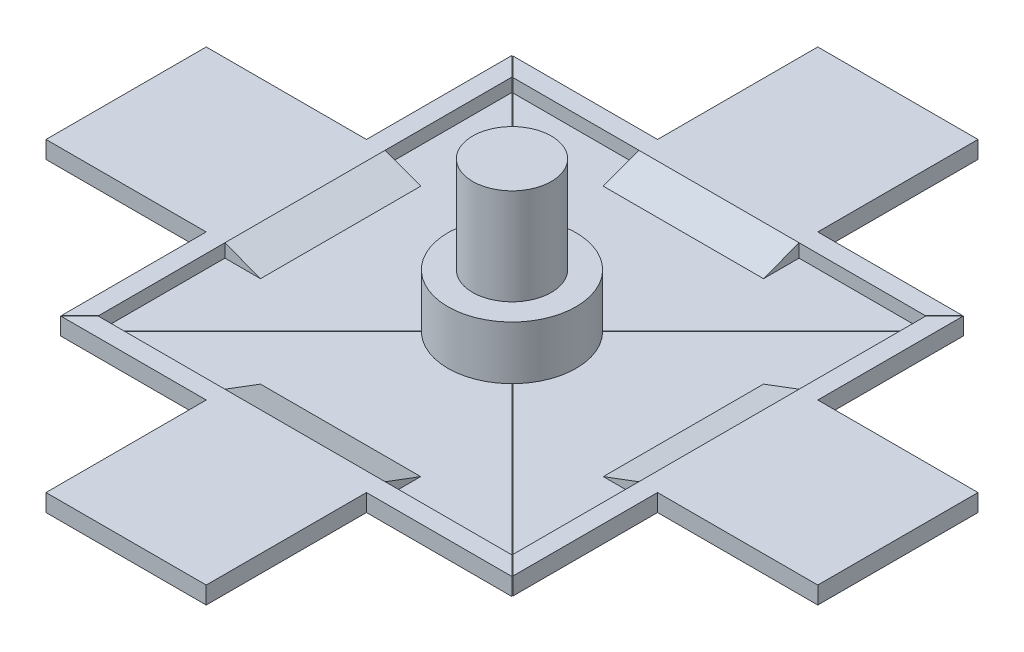
from build123d import *

# Parameters (mm, degrees)
PLYWOOD_BASE_DEPTH           = 19.05
FIELD_LAYOUT_3_W             = 1968.5
FIELD_LAYOUT_3_H             = 1968.5
RAISED_BASE_DEPTH            = 63.5
FIELD_LAYOUT_4_W             = 762
FIELD_LAYOUT_4_H             = 169.138249808
RAMP_EXTRUDE_DEPTH           = 63.5
CUT_RAMP_SLOPE_REACH         = 2880.042
COPY_RAMP_SLOPE_COUNT        = 4
SKETCH5_R                    = 304.8
BOSS_EXTRUDE1_DEPTH          = 254
CUT_EXTRUDE_THIN1_DEPTH      = 2608.693817341
CUT_EXTRUDE_THIN1_DEPTH_BACK = 2608.693817341
SKETCH6_R                    = 187.226802171
BOSS_EXTRUDE2_DEPTH          = 457.2


with BuildPart() as part:
    # Field Layout → Plywood Base (new body)
    with BuildSketch(Plane(origin=(0, 0, 0), x_dir=(1, 0, 0), z_dir=(0, 1, 0))):
        Polygon((-381, 1073.15), (-1073.15, 1073.15), (-1073.15, 381), (-1835.15, 381), (-1835.15, -381), (-1073.15, -381), (-1073.15, -1073.15), (-381, -1073.15), (-381, -1835.15), (381, -1835.15), (381, -1073.15), (1073.15, -1073.15), (1073.15, -381), (1835.15, -381), (1835.15, 381), (1073.15, 381), (1073.15, 1073.15), (381, 1073.15), (381, 1835.15), (-381, 1835.15), align=None)
    extrude(amount=-PLYWOOD_BASE_DEPTH)

    # Field Layout<3> → Raised Base (add)
    with BuildSketch(Plane(origin=(0, 0, 0), x_dir=(1, 0, 0), z_dir=(0, 1, 0))):
        Polygon((-381, 1073.15), (-1073.15, 1073.15), (-1073.15, 381), (-1835.15, 381), (-1835.15, -381), (-1073.15, -381), (-1073.15, -1073.15), (-381, -1073.15), (-381, -1835.15), (381, -1835.15), (381, -1073.15), (1073.15, -1073.15), (1073.15, -381), (1835.15, -381), (1835.15, 381), (1073.15, 381), (1073.15, 1073.15), (381, 1073.15), (381, 1835.15), (-381, 1835.15), align=None)
        Rectangle(FIELD_LAYOUT_3_W, FIELD_LAYOUT_3_H, mode=Mode.SUBTRACT)
    extrude(amount=RAISED_BASE_DEPTH)

    # Field Layout<4> → Ramp Extrude (add)
    with BuildSketch(Plane(origin=(0, 0, 0), x_dir=(1, 0, 0), z_dir=(0, 1, 0))):
        with Locations((0, -899.680875096)):
            Rectangle(FIELD_LAYOUT_4_W, FIELD_LAYOUT_4_H)
    ramp_extrude = extrude(amount=RAMP_EXTRUDE_DEPTH)

    # Sketch3 → Cut ramp slope (cut, up to next)
    with BuildSketch(Plane(origin=(381, 0, 0), x_dir=(0, 0, -1), z_dir=(1, 0, 0)), mode=Mode.PRIVATE) as cut_ramp_slope_sk1:
        Polygon((-815.111750192, 63.5), (-984.25, 63.5), (-815.111750192, 0), align=None)
    cut_ramp_slope_tool1 = extrude(cut_ramp_slope_sk1.sketch, amount=-CUT_RAMP_SLOPE_REACH, mode=Mode.PRIVATE) & part.part
    cut_ramp_slope = cut_ramp_slope_tool1.solids().sort_by_distance((381, 42.333333, 871.491167))[0]
    add(cut_ramp_slope, mode=Mode.SUBTRACT)

    # Copy Ramp Slope: Ramp Extrude, Cut ramp slope ×4 about axis
    copy_ramp_slope_axis = Axis((0, -19.05, 0), (0, -1, 0))
    add([ramp_extrude.rotate(copy_ramp_slope_axis, i * 360 / COPY_RAMP_SLOPE_COUNT) for i in range(1, COPY_RAMP_SLOPE_COUNT)])
    add([cut_ramp_slope.rotate(copy_ramp_slope_axis, i * 360 / COPY_RAMP_SLOPE_COUNT) for i in range(1, COPY_RAMP_SLOPE_COUNT)], mode=Mode.SUBTRACT)

    # Sketch4 → Cut-Extrude-Thin1 (cut, two sides: drawn at the far end of the back side and taken through both)
    with BuildSketch(Plane(origin=(0, 0, 0), x_dir=(1, 0, 0), z_dir=(0, 1, 0)).offset(-CUT_EXTRUDE_THIN1_DEPTH_BACK)):
        Polygon((-1073.15, -1073.15), (-984.25, -984.25), (984.25, 984.25), (1073.15, 1073.15), (1071.353948776, 1074.946051224), (982.453948776, 986.046051224), (-986.046051224, -982.453948776), (-1074.946051224, -1071.353948776), align=None)
        Polygon((-1073.15, 1073.15), (-984.25, 984.25), (984.25, -984.25), (1073.15, -1073.15), (1074.946051224, -1071.353948776), (986.046051224, -982.453948776), (-982.453948776, 986.046051224), (-1071.353948776, 1074.946051224), align=None)
    extrude(amount=CUT_EXTRUDE_THIN1_DEPTH + CUT_EXTRUDE_THIN1_DEPTH_BACK, mode=Mode.SUBTRACT)


with BuildPart() as body_2:
    # Sketch5 → Boss-Extrude1 (new body)
    with BuildSketch(Plane(origin=(0, 0, 0), x_dir=(1, 0, 0), z_dir=(0, 1, 0))):
        Circle(SKETCH5_R)
    extrude(amount=BOSS_EXTRUDE1_DEPTH)

    # Sketch6 → Boss-Extrude2 (add)
    with BuildSketch(Plane(origin=(0, 254, 0), x_dir=(1, 0, 0), z_dir=(0, 1, 0))):
        Circle(SKETCH6_R)
    extrude(amount=BOSS_EXTRUDE2_DEPTH)


with BuildPart() as cut_extrude_thin1_piece_1:
    # of the separate pieces the step leaves, piece 1, a body of its own (cut_extrude_thin1_pieces)
    add(part.part.solids().sort_by_distance((0, -19.05, 0))[0])


with BuildPart() as cut_extrude_thin1_piece_2:
    # of the separate pieces the step leaves, piece 2, a body of its own (cut_extrude_thin1_pieces)
    add(part.part.solids().sort_by_distance((-1073.15, -19.05, -1073.15))[0])


with BuildPart() as cut_extrude_thin1_piece_3:
    # of the separate pieces the step leaves, piece 3, a body of its own (cut_extrude_thin1_pieces)
    add(part.part.solids().sort_by_distance((1073.15, 63.5, -381))[0])


with BuildPart() as cut_extrude_thin1_piece_4:
    # of the separate pieces the step leaves, piece 4, a body of its own (cut_extrude_thin1_pieces)
    add(part.part.solids().sort_by_distance((-381, 63.5, -1073.15))[0])


solid = Compound([body_2.part, cut_extrude_thin1_piece_1.part, cut_extrude_thin1_piece_2.part, cut_extrude_thin1_piece_3.part, cut_extrude_thin1_piece_4.part])
